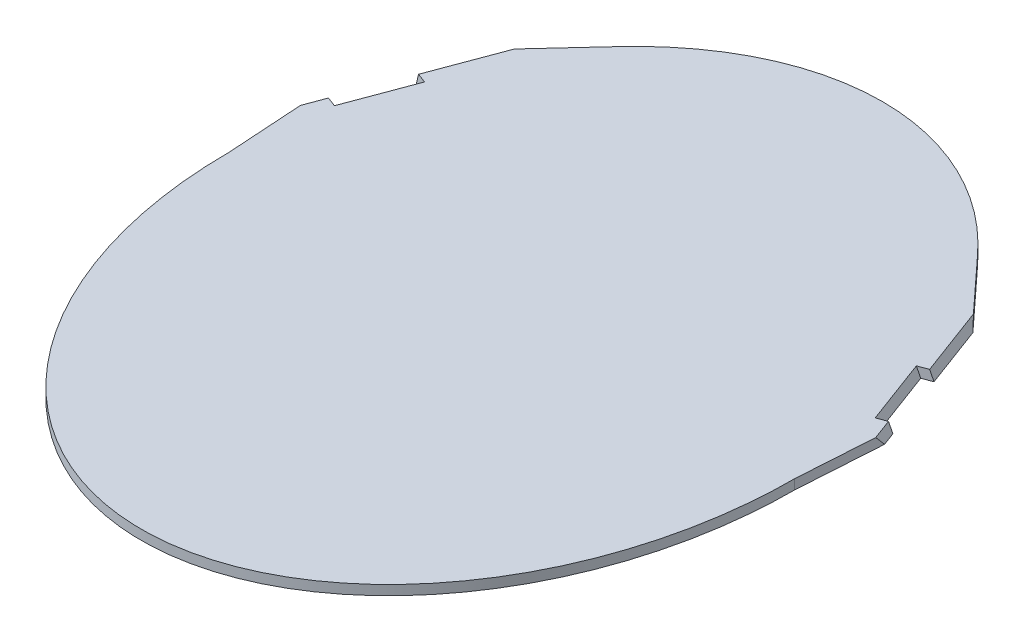
from build123d import *

# Parameters (mm, degrees)
SKETCH1_RX          = 380
SKETCH1_RY          = 290
BOSS_EXTRUDE1_DEPTH = 10
BOSS_EXTRUDE2_DEPTH = 10
CUT_EXTRUDE1_DEPTH  = 10
SKETCH8_W           = 355.795250099
SKETCH8_H           = 262.515596516
CUT_EXTRUDE2_DEPTH  = 736.760828118


with BuildPart() as part:
    # Sketch1 → Boss-Extrude1 (new body)
    with BuildSketch(Plane(origin=(0, 0, 0), x_dir=(1, 0, 0), z_dir=(0, 1, 0))):
        with Locations(Location((0, 0), (0, 0, 90))):
            Ellipse(SKETCH1_RX, SKETCH1_RY)
    extrude(amount=BOSS_EXTRUDE1_DEPTH)

    # Sketch2 → Boss-Extrude2 (add)
    with BuildSketch(Plane(origin=(0, 10, 0), x_dir=(1, 0, 0), z_dir=(0, 1, 0))):
        Polygon((287.228032818, 98.993347022), (277.229646496, 95.262936552), (290, 0), (296.597160239, 102.488980208), align=None)
        Polygon((-296.597160239, 102.488980208), (-290, 0), (-277.229646496, 95.262936552), (-287.228032818, 98.993347022), align=None)
        Polygon((244.797124663, 227.718261487), (188.989530622, 288.225103524), (257.336277473, 164.50388217), (262.120047497, 166.288712763), (271.489174918, 169.784345949), (266.534927877, 209.025181731), align=None)
        Polygon((-266.534927877, 209.025181731), (-271.489174918, 169.784345949), (-262.120047497, 166.288712763), (-257.336277473, 164.50388217), (-188.989530622, 288.225103524), (-244.797124663, 227.718261487), align=None)
    extrude(amount=-BOSS_EXTRUDE2_DEPTH)

    # Sketch4 → Cut-Extrude1 (cut)
    with BuildSketch(Plane(origin=(256.485650454, 95.695117721, -95.695117721), x_dir=(-0.3091654315444493, -0.11535001008591973, -0.943986817233754), z_dir=(0.8844332774281067, 0.32998316455372434, -0.32998316455371984))):
        Polygon((4.647435865, -100.404384349), (0.972491464, -70.555212825), (72.260950701, -61.778382153), (74.730936612, -81.840463395), (75.935895102, -91.627553677), align=None)
    cut_extrude1 = extrude(amount=-CUT_EXTRUDE1_DEPTH, mode=Mode.SUBTRACT)

    # Mirror1: Cut-Extrude1 across plane
    add(cut_extrude1.mirror(Plane(origin=(0, 0, 0), x_dir=(0, 0, 1), z_dir=(1, 0, 0))), mode=Mode.SUBTRACT)

    # Sketch8 → Cut-Extrude2 (cut, through all)
    with BuildSketch(Plane(origin=(256.485650454, 95.695117721, -95.695117721), x_dir=(-0.3091654315444493, -0.11535001008591973, -0.943986817233754), z_dir=(0.8844332774281067, 0.32998316455372434, -0.32998316455371984))):
        with Locations((60.595009972, -108.189381189)):
            Rectangle(SKETCH8_W, SKETCH8_H)
    cut_extrude2 = extrude(amount=CUT_EXTRUDE2_DEPTH, mode=Mode.SUBTRACT)

    # Mirror2: Cut-Extrude2 across plane
    add(cut_extrude2.mirror(Plane(origin=(0, 0, 0), x_dir=(0, 0, 1), z_dir=(1, 0, 0))), mode=Mode.SUBTRACT)


solid = part.part
